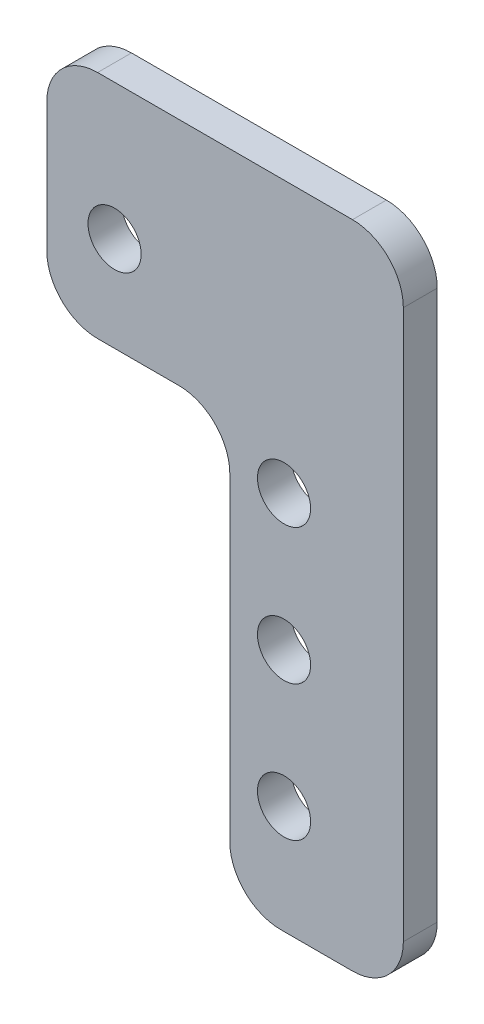
from build123d import *

# Parameters (mm, degrees)
SKETCH1_R           = 2.4892
BOSS_EXTRUDE1_DEPTH = 3.175
FILLET1_R           = 4.7625


with BuildPart() as part:
    # Sketch1 → Boss-Extrude1 (new body)
    with BuildSketch(Plane.XY):
        Polygon((28.575, -2.54), (61.976, -2.54), (61.976, -63.5), (45.72, -63.5), (45.72, -24.13), (28.575, -24.13), align=None)
        with Locations((50.8, -27.94)):
            Circle(SKETCH1_R, mode=Mode.SUBTRACT)
        with Locations((50.8, -40.64)):
            Circle(SKETCH1_R, mode=Mode.SUBTRACT)
        with Locations((50.8, -53.34)):
            Circle(SKETCH1_R, mode=Mode.SUBTRACT)
        with Locations((34.925, -15.24)):
            Circle(SKETCH1_R, mode=Mode.SUBTRACT)
    extrude(amount=BOSS_EXTRUDE1_DEPTH)

    # Fillet1
    fillet1_edges = [part.edges().sort_by_distance(p)[0] for p in [
        (61.976, -63.5, 1.5875),
        (45.72, -63.5, 1.5875),
        (45.72, -24.13, 1.5875),
        (28.575, -24.13, 1.5875),
        (28.575, -2.54, 1.5875),
        (61.976, -2.54, 1.5875),
    ]]
    fillet(fillet1_edges, radius=FILLET1_R)


solid = part.part
